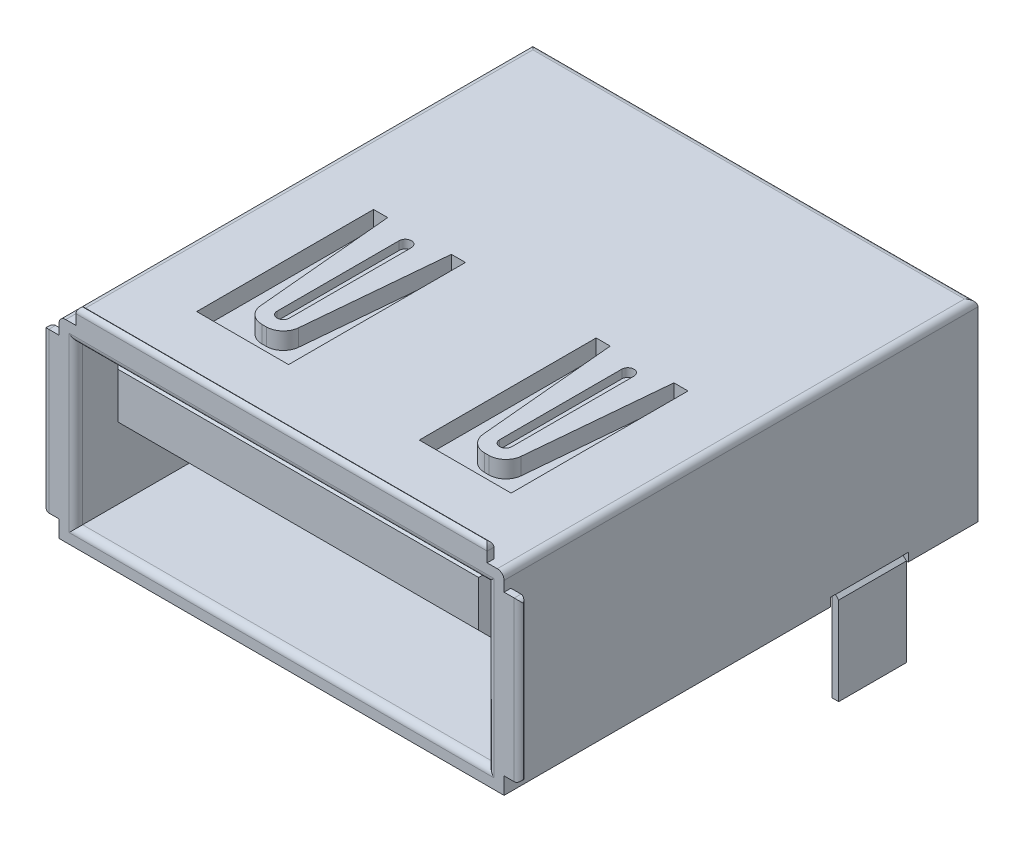
from build123d import *

# Parameters (mm, degrees)
SKETCH_1_W             = 13.15
SKETCH_1_H             = 5.7
SKETCH_1_W_2           = 12.15
SKETCH_1_H_2           = 4.7
EXTRUDE_1_DEPTH        = 14
SKETCH_2_W             = 13.15
SKETCH_2_H             = 5.7
EXTRUDE_2_DEPTH        = 0.5
SKETCH_3_W             = 11.15
SKETCH_3_H             = 1.85
EXTRUDE_3_DEPTH        = 13
CHAMFER_1_SIZE         = 0.25
SKETCH_4_R             = 0.46
SKETCH_4_R_2           = 1.15
CUT_EXTRUDE_2_DEPTH    = 0.25
SKETCH_7_W             = 0.75
SKETCH_7_H             = 0.2
SKETCH_7_W_2           = 0.7
SKETCH_7_W_3           = 0.2
SKETCH_7_H_2           = 2
EXTRUDE_4_DEPTH        = 2.8
CHAMFER_3_SIZE         = 0.1
CHAMFER_4_SIZE         = 0.1
CUT_EXTRUDE_3_DEPTH    = 0.5
CUT_EXTRUDE_4_DEPTH    = 0.25
FILLET_1_R             = 0.5
SKETCH_11_W            = 0.2
SKETCH_11_H            = 4.7
EXTRUDE_5_DEPTH        = 0.5
FILLET_2_R             = 0.2
FILLET_2_OF_MIRROR_1_R = 0.2
SKETCH_12_W            = 12.15
SKETCH_12_H            = 0.2
EXTRUDE_6_DEPTH        = 0.5
FILLET_3_R             = 0.2
FILLET_4_R             = 0.2
FILLET_5_R             = 0.2


# Some blends are built 0.0001 mm under size
with BuildPart() as part:
    # 草图1 → 凸台-拉伸1 (new body)
    with BuildSketch(Plane.XY):
        Rectangle(SKETCH_1_W, SKETCH_1_H)
        Rectangle(SKETCH_1_W_2, SKETCH_1_H_2, mode=Mode.SUBTRACT)
    extrude(amount=EXTRUDE_1_DEPTH)

    # 草图2 → 凸台-拉伸2 (add)
    with BuildSketch(Plane.XY):
        Rectangle(SKETCH_2_W, SKETCH_2_H)
    extrude(amount=EXTRUDE_2_DEPTH)

    # 草图4 → 切除-拉伸2 (cut)
    with BuildSketch(Plane.XZ.offset(2.85)):
        with Locations(Location((-1, 0.5, 0), (0, 0, 270))):
            Circle(SKETCH_4_R)
        with Locations(Location((1, 0.5, 0), (0, 0, 270))):
            Circle(SKETCH_4_R)
        with Locations(Location((-3.5, 0.5, 0), (0, 0, 270))):
            Circle(SKETCH_4_R)
        with Locations(Location((3.5, 0.5, 0), (0, 0, 270))):
            Circle(SKETCH_4_R)
        with Locations((-6.57, 3.21)):
            Circle(SKETCH_4_R_2)
        with Locations((6.57, 3.21)):
            Circle(SKETCH_4_R_2)
    extrude(amount=-CUT_EXTRUDE_2_DEPTH, mode=Mode.SUBTRACT)

    # 草图7 → 凸台-拉伸4 (add)
    with BuildSketch(Plane(origin=(0, -2.6, -2.85), x_dir=(-1, 0, 0), z_dir=(0, 1, 0))):
        with Locations((-3.5, 3.35)):
            Rectangle(SKETCH_7_W, SKETCH_7_H)
        with Locations((-1, 3.35)):
            Rectangle(SKETCH_7_W_2, SKETCH_7_H)
        with Locations((3.5, 3.35)):
            Rectangle(SKETCH_7_W, SKETCH_7_H)
        with Locations((1, 3.35)):
            Rectangle(SKETCH_7_W_2, SKETCH_7_H)
        with Locations((6.57, 6.06)):
            Rectangle(SKETCH_7_W_3, SKETCH_7_H_2)
        with Locations((-6.57, 6.06)):
            Rectangle(SKETCH_7_W_3, SKETCH_7_H_2)
    extrude(amount=-EXTRUDE_4_DEPTH)

    # 倒角3
    # the kernel refuses this chamfer: 0.1 mm, written as the material it takes off along each edge
    with BuildSketch(Plane(origin=(6.67, -2.6, 1.952831701), x_dir=(-0.9996219169112966, 0.02749587661058742, 0), z_dir=(0, 0, 1))) as chamfer_3_piece_1_section:
        Polygon((CHAMFER_3_SIZE * 0.999621916911, CHAMFER_3_SIZE * 0.0274958766106), (-CHAMFER_3_SIZE * 0.0274958766106, CHAMFER_3_SIZE * 0.999621916911), (0, 0), align=None)
    chamfer_3_piece_1 = extrude(amount=2.514336598, mode=Mode.PRIVATE)
    chamfer_3_piece_1 = split(chamfer_3_piece_1, bisect_by=Plane(origin=(6.575, -2.63325446, 3.21), z_dir=(1, 0, 0)), keep=Keep.TOP, mode=Mode.PRIVATE)
    add(chamfer_3_piece_1, mode=Mode.SUBTRACT)
    with BuildSketch(Plane(origin=(-6.67, -2.6, 1.952831701), x_dir=(0.9996219169112966, 0.02749587661058742, 0), z_dir=(0, 0, 1))) as chamfer_3_piece_2_section:
        Polygon((CHAMFER_3_SIZE * 0.999621916911, -CHAMFER_3_SIZE * 0.0274958766106), (-CHAMFER_3_SIZE * 0.0274958766106, -CHAMFER_3_SIZE * 0.999621916911), (0, 0), align=None)
    chamfer_3_piece_2 = extrude(amount=2.514336598, mode=Mode.PRIVATE)
    chamfer_3_piece_2 = split(chamfer_3_piece_2, bisect_by=Plane(origin=(-6.575, -2.63325446, 3.21), z_dir=(-1, 0, 0)), keep=Keep.TOP, mode=Mode.PRIVATE)
    add(chamfer_3_piece_2, mode=Mode.SUBTRACT)

    # 倒角4
    chamfer_4_edges = [part.edges().sort_by_distance(p)[0] for p in [
        (-0.65, -5.4, 0.5),
        (-1, -5.4, 0.6),
        (-1.35, -5.4, 0.5),
        (-1, -5.4, 0.4),
        (3.5, -5.4, 0.6),
        (3.125, -5.4, 0.5),
        (3.5, -5.4, 0.4),
        (3.875, -5.4, 0.5),
        (1, -5.4, 0.6),
        (0.65, -5.4, 0.5),
        (1, -5.4, 0.4),
        (1.35, -5.4, 0.5),
        (-6.67, -5.4, 3.21),
        (-6.57, -5.4, 2.21),
        (-6.47, -5.4, 3.21),
        (-6.57, -5.4, 4.21),
        (6.67, -5.4, 3.21),
        (6.57, -5.4, 4.21),
        (6.47, -5.4, 3.21),
        (6.57, -5.4, 2.21),
        (-3.125, -5.4, 0.5),
        (-3.5, -5.4, 0.6),
        (-3.875, -5.4, 0.5),
        (-3.5, -5.4, 0.4),
    ]]
    chamfer(chamfer_4_edges, length=CHAMFER_4_SIZE - 0.0001)  # a hair under: the kernel refuses the full size

    # 草图8 → 切除-拉伸3 (cut)
    with BuildSketch(Plane(origin=(0, 2.85, 0), x_dir=(1, 0, 0), z_dir=(0, 1, 0))):
        Polygon((-3.808819217, -11.224979928), (-2.766180783, -11.224979928), (-2.346891912, -6.635867656), (-1.930541709, -6.635867656), (-1.930541709, -11.86178054), (-4.644458291, -11.86178054), (-4.644458291, -6.635867656), (-4.228108088, -6.635867656), align=None)
        Polygon((3.808819217, -11.224979928), (4.228108088, -6.635867656), (4.644458291, -6.635867656), (4.644458291, -11.86178054), (1.930541709, -11.86178054), (1.930541709, -6.635867656), (2.346891912, -6.635867656), (2.766180783, -11.224979928), align=None)
    extrude(amount=-CUT_EXTRUDE_3_DEPTH, mode=Mode.SUBTRACT)

    # 草图9 → 切除-拉伸4 (cut)
    with BuildSketch(Plane(origin=(0, 2.85, 0), x_dir=(1, 0, 0), z_dir=(0, 1, 0))):
        with BuildLine():
            Line((-3.467306843, -10.663035767), (-3.467306843, -7.056248419))
            ThreePointArc((-3.467306843, -7.056248419), (-3.2875, -6.876441576), (-3.107693157, -7.056248419))
            Line((-3.107693157, -7.056248419), (-3.107693157, -10.663035767))
            ThreePointArc((-3.107693157, -10.663035767), (-3.2875, -10.842842609), (-3.467306843, -10.663035767))
        make_face()
        with BuildLine():
            Line((3.467306843, -10.663035767), (3.467306843, -7.056248419))
            ThreePointArc((3.467306843, -7.056248419), (3.2875, -6.876441576), (3.107693157, -7.056248419))
            Line((3.107693157, -7.056248419), (3.107693157, -10.663035767))
            ThreePointArc((3.107693157, -10.663035767), (3.2875, -10.842842609), (3.467306843, -10.663035767))
        make_face()
    extrude(amount=-CUT_EXTRUDE_4_DEPTH, mode=Mode.SUBTRACT)

    # 圆角1
    fillet_1_edges = [part.edges().sort_by_distance(p)[0] for p in [
        (-3.808819217, 2.6, 11.224979928),
        (-2.766180783, 2.6, 11.224979928),
        (2.766180783, 2.6, 11.224979928),
        (3.808819217, 2.6, 11.224979928),
    ]]
    fillet(fillet_1_edges, radius=FILLET_1_R)

    # 草图11 → 凸台-拉伸5 (add)
    with BuildSketch(Plane.ZY.offset(6.575)):
        with Locations((13.9, 0)):
            Rectangle(SKETCH_11_W, SKETCH_11_H)
    extrude_5 = extrude(amount=EXTRUDE_5_DEPTH)

    # 圆角2
    # the kernel refuses this fillet: 0.2 mm, written as the material it takes off along each edge
    with BuildSketch(Plane(origin=(-7.075, -2.85, 14), x_dir=(1, 0, 0), z_dir=(0, 1, 0)), Plane(origin=(-7.075, 2.85, 13.8), x_dir=(1, 0, 0), z_dir=(0, -1, 0))) as fillet_2_piece_1:
        with BuildLine():
            CenterArc((FILLET_2_R, FILLET_2_R), FILLET_2_R, 180, 90)
            Line((0, FILLET_2_R), (0, 0))
            Line((0, 0), (FILLET_2_R, 0))
        make_face()
    extrude(amount=5.7, mode=Mode.SUBTRACT)
    with BuildSketch(Plane(origin=(-7.075, 2.35, 14.5), x_dir=(1, 0, 0), z_dir=(0, 0, -1)), Plane(origin=(-7.075, -2.35, 13.3), x_dir=(1, 0, 0), z_dir=(0, 0, 1))) as fillet_2_piece_2:
        with BuildLine():
            CenterArc((FILLET_2_R, FILLET_2_R), FILLET_2_R, 180, 90)
            Line((0, FILLET_2_R), (0, 0))
            Line((0, 0), (FILLET_2_R, 0))
        make_face()
    extrude(amount=1.2, mode=Mode.SUBTRACT)

    # 镜向1: 凸台-拉伸5 across plane
    add(extrude_5.mirror(Plane(origin=(0, 0, 0), x_dir=(0, 0, 1), z_dir=(1, 0, 0))))

    # 圆角2 of 镜向1
    # the kernel refuses this fillet: 0.2 mm, written as the material it takes off along each edge
    with BuildSketch(Plane(origin=(7.075, -2.85, 14), x_dir=(-1, 0, 0), z_dir=(0, 1, 0)), Plane(origin=(7.075, 2.85, 13.8), x_dir=(-1, 0, 0), z_dir=(0, -1, 0))) as fillet_2_of_mirror_1_piece_1:
        with BuildLine():
            CenterArc((FILLET_2_OF_MIRROR_1_R, -FILLET_2_OF_MIRROR_1_R), FILLET_2_OF_MIRROR_1_R, 90, 90)
            Line((0, -FILLET_2_OF_MIRROR_1_R), (0, 0))
            Line((0, 0), (FILLET_2_OF_MIRROR_1_R, 0))
        make_face()
    extrude(amount=5.7, mode=Mode.SUBTRACT)
    with BuildSketch(Plane(origin=(7.075, 2.35, 14.5), x_dir=(-1, 0, 0), z_dir=(0, 0, -1)), Plane(origin=(7.075, -2.35, 13.3), x_dir=(-1, 0, 0), z_dir=(0, 0, 1))) as fillet_2_of_mirror_1_piece_2:
        with BuildLine():
            CenterArc((FILLET_2_OF_MIRROR_1_R, -FILLET_2_OF_MIRROR_1_R), FILLET_2_OF_MIRROR_1_R, 90, 90)
            Line((0, -FILLET_2_OF_MIRROR_1_R), (0, 0))
            Line((0, 0), (FILLET_2_OF_MIRROR_1_R, 0))
        make_face()
    extrude(amount=1.2, mode=Mode.SUBTRACT)

    # 草图12 → 凸台-拉伸6 (add)
    with BuildSketch(Plane(origin=(0, 2.85, 0), x_dir=(1, 0, 0), z_dir=(0, 1, 0))):
        with Locations((0, -13.9)):
            Rectangle(SKETCH_12_W, SKETCH_12_H)
    extrude(amount=EXTRUDE_6_DEPTH)

    # 圆角3
    # the kernel refuses this fillet: 0.2 mm, written as the material it takes off along each edge
    with BuildSketch(Plane(origin=(-6.075, 3.35, 13.3), x_dir=(0, -1, 0), z_dir=(0, 0, 1)), Plane(origin=(6.075, 3.35, 14.5), x_dir=(0, -1, 0), z_dir=(0, 0, -1))) as fillet_3_piece_1:
        with BuildLine():
            CenterArc((FILLET_3_R, FILLET_3_R), FILLET_3_R, 180, 90)
            Line((0, FILLET_3_R), (0, 0))
            Line((0, 0), (FILLET_3_R, 0))
        make_face()
    extrude(amount=1.2, mode=Mode.SUBTRACT)
    with BuildSketch(Plane(origin=(-6.575, 3.35, 14), x_dir=(0, -1, 0), z_dir=(1, 0, 0)), Plane(origin=(6.575, 3.35, 13.8), x_dir=(0, -1, 0), z_dir=(-1, 0, 0))) as fillet_3_piece_2:
        with BuildLine():
            CenterArc((FILLET_3_R, FILLET_3_R), FILLET_3_R, 180, 90)
            Line((0, FILLET_3_R), (0, 0))
            Line((0, 0), (FILLET_3_R, 0))
        make_face()
    extrude(amount=13.15, mode=Mode.SUBTRACT)

    # 圆角4
    fillet_4_edges = [part.edges().sort_by_distance(p)[0] for p in [
        (6.075, 0, 14),
        (0, 2.35, 14),
        (-6.075, 0, 14),
        (0, -2.35, 14),
    ]]
    fillet(fillet_4_edges, radius=FILLET_4_R)

    # 圆角5
    fillet_5_edges = [part.edges().sort_by_distance(p)[0] for p in [
        (0, 2.85, 0),
        (-6.575, 2.85, 7),
        (6.575, 2.85, 7),
    ]]
    fillet(fillet_5_edges, radius=FILLET_5_R)


with BuildPart() as body_2:
    # 草图3 → 凸台-拉伸3 (new body)
    with BuildSketch(Plane.XY.offset(0.5)):
        with Locations((0, 1.175)):
            Rectangle(SKETCH_3_W, SKETCH_3_H)
    extrude(amount=EXTRUDE_3_DEPTH)

    # 倒角1
    chamfer_1_edges = [body_2.edges().sort_by_distance(p)[0] for p in [
        (5.575, 1.175, 13.5),
        (0, 2.1, 13.5),
        (-5.575, 1.175, 13.5),
        (0, 0.25, 13.5),
    ]]
    chamfer(chamfer_1_edges, length=CHAMFER_1_SIZE)


solid = Compound([part.part, body_2.part])
